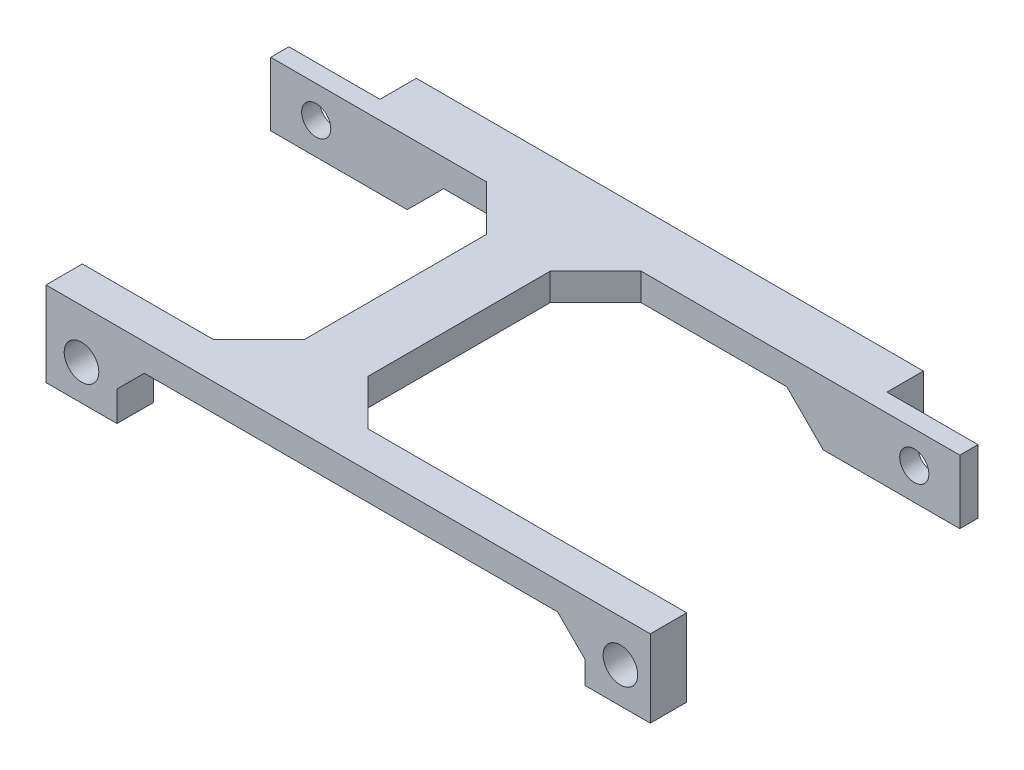
from build123d import *

# Parameters (mm, degrees)
SKETCH2_W           = 10
SKETCH2_H           = 2
SKETCH2_W_2         = 7
SKETCH2_H_2         = 34
BOSS_EXTRUDE1_DEPTH = 7
CUT_EXTRUDE1_REACH  = 91.384
SKETCH4_W           = 41.7
SKETCH4_H           = 4
SKETCH6_W           = 11.583545394
SKETCH6_H           = 3
SKETCH6_W_2         = 32.816454606
SKETCH6_W_3         = 7.183545394
SKETCH6_H_2         = 8.505079478
SKETCH6_R           = 1.9
SKETCH6_W_4         = 7.8
SKETCH6_H_3         = 9.292079478
BOSS_EXTRUDE2_DEPTH = 4
CHAMFER1_SIZE       = 5
CHAMFER2_SIZE       = 3
CHAMFER7_SIZE       = 2
SKETCH7_R           = 1.6
CUT_EXTRUDE2_DEPTH  = 3.5


with BuildPart() as part:
    # Sketch2 → Boss-Extrude1 (new body)
    with BuildSketch(Plane(origin=(0, -3.05, 0), x_dir=(1, 0, 0), z_dir=(0, 1, 0))):
        with Locations((74.3, -1)):
            Rectangle(SKETCH2_W, SKETCH2_H)
        Polygon((69.3, -2), (69.3, 0), (69.3, 4), (13.6, 4), (13.6, 0), (13.6, -2), (32.3, -2), (39.3, -2), align=None)
        with Locations((35.8, -19)):
            Rectangle(SKETCH2_W_2, SKETCH2_H_2)
        with Locations((8.6, -1)):
            Rectangle(SKETCH2_W, SKETCH2_H)
    extrude(amount=-BOSS_EXTRUDE1_DEPTH)

    # Cut-Extrude1: up to this face of the body (flat: up to its plane)
    cut_extrude1_end = Plane(part.part.faces().sort_by_distance((35.8, -6.55, 36))[0])
    # Sketch4 → Cut-Extrude1 (cut, up to the picked face)
    with BuildSketch(Plane(origin=(0, 0, -4), x_dir=(-1, 0, 0), z_dir=(0, 0, -1)), mode=Mode.PRIVATE) as cut_extrude1_sk1:
        with Locations((-41.45, -8.05)):
            Rectangle(SKETCH4_W, SKETCH4_H)
    cut_extrude1_tool1 = split(extrude(cut_extrude1_sk1.sketch, amount=-CUT_EXTRUDE1_REACH, mode=Mode.PRIVATE), bisect_by=cut_extrude1_end, keep=Keep.BOTH, mode=Mode.PRIVATE)
    add(cut_extrude1_tool1.solids().sort_by(Axis((41.45, -8.05, -4), (0, 0, 1)))[0], mode=Mode.SUBTRACT)

    # Sketch6 → Boss-Extrude2 (add)
    # profile 1 of 4: a face of its own
    with BuildSketch(Plane.XY.offset(36)):
        with Locations((26.508227303, -4.55)):
            Rectangle(SKETCH6_W, SKETCH6_H)
    # profile 2 of 4: a face of its own
    with BuildSketch(Plane.XY.offset(36)):
        with Locations((55.708227303, -4.55)):
            Rectangle(SKETCH6_W_2, SKETCH6_H)
    # profile 3 of 4: a face of its own
    with BuildSketch(Plane.XY.offset(36)):
        with Locations((75.708227303, -7.302539739)):
            Rectangle(SKETCH6_W_3, SKETCH6_H_2)
        with Locations((76.016454606, -7.655079478)):
            Circle(SKETCH6_R, mode=Mode.SUBTRACT)
    # profile 4 of 4: a face of its own
    with BuildSketch(Plane.XY.offset(36)):
        with Locations((16.816454606, -7.696039739)):
            Rectangle(SKETCH6_W_4, SKETCH6_H_3)
        with Locations((16.816454606, -8.442079478)):
            Circle(SKETCH6_R, mode=Mode.SUBTRACT)
    extrude(amount=-BOSS_EXTRUDE2_DEPTH)

    # Chamfer1
    chamfer1_edges = [part.edges().sort_by_distance(p)[0] for p in [
        (39.3, -4.55, 2),
        (32.3, -4.55, 2),
        (39.3, -4.55, 32),
        (32.3, -4.55, 32),
    ]]
    chamfer(chamfer1_edges, length=CHAMFER1_SIZE)

    # Chamfer2
    chamfer2_edges = [part.edges().sort_by_distance(p)[0] for p in [
        (72.116454606, -6.05, 34),
        (20.716454606, -6.05, 34),
    ]]
    chamfer(chamfer2_edges, length=CHAMFER2_SIZE)

    # Chamfer7
    chamfer7_edges = [part.edges().sort_by_distance(p)[0] for p in [
        (62.3, -6.05, -1),
        (20.6, -6.05, -1),
    ]]
    chamfer(chamfer7_edges, length=CHAMFER7_SIZE)
    chamfer7_2_edges = [part.edges().sort_by_distance(p)[0] for p in [
        (62.3, -10.05, -1),
        (20.6, -10.05, -1),
    ]]
    chamfer(chamfer7_2_edges, length=CHAMFER7_SIZE - 0.0001)  # a hair under: the kernel refuses the full size

    # Sketch7 → Cut-Extrude2 (cut)
    with BuildSketch(Plane(origin=(0, 0, 0), x_dir=(-1, 0, 0), z_dir=(0, 0, -1))):
        with Locations(Location((-74.3, -6.55, 0), (0, 0, 90))):
            Circle(SKETCH7_R)
        with Locations(Location((-8.6, -6.55, 0), (0, 0, 90))):
            Circle(SKETCH7_R)
    extrude(amount=-CUT_EXTRUDE2_DEPTH, mode=Mode.SUBTRACT)


solid = part.part
